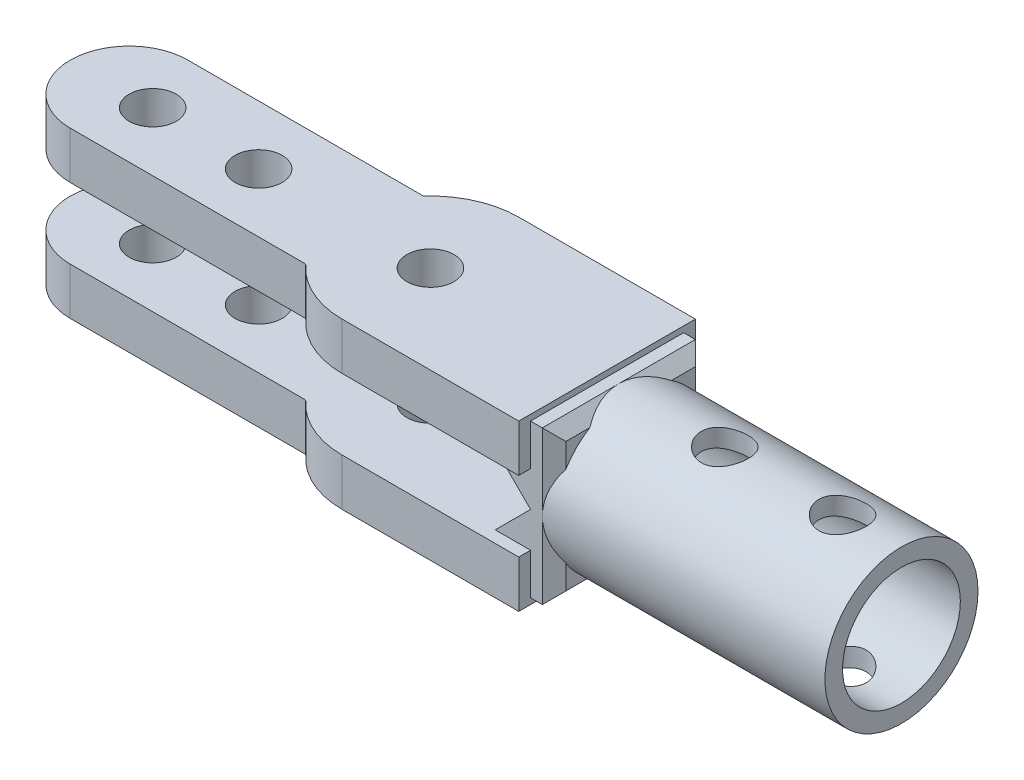
from build123d import *

# Parameters (mm, degrees)
SKETCH1_R               = 6.5
SKETCH1_R_2             = 5
BOSS_EXTRUDE1_DEPTH     = 23
SKETCH2_W               = 13
SKETCH2_H               = 13
BOSS_EXTRUDE2_DEPTH     = 2
CUT_EXTRUDE1_DEPTH      = 25.768932153
CUT_EXTRUDE1_DEPTH_BACK = 25.768932153
SKETCH4_R               = 2
SKETCH5_R               = 2
BOSS_EXTRUDE5_DEPTH     = 4
CHAMFER2_SIZE           = 3
CHAMFER3_SIZE           = 1


# Some blends are built 0.0001 mm under size
with BuildPart() as part:
    # Sketch1 → Boss-Extrude1 (new body)
    with BuildSketch(Plane(origin=(0, 0, 0), x_dir=(0, 0, -1), z_dir=(1, 0, 0))):
        Circle(SKETCH1_R)
        Circle(SKETCH1_R_2, mode=Mode.SUBTRACT)
    extrude(amount=BOSS_EXTRUDE1_DEPTH)

    # Sketch2 → Boss-Extrude2 (add)
    with BuildSketch(Plane(origin=(0, 0, 0), x_dir=(0, 0, -1), z_dir=(1, 0, 0))):
        Rectangle(SKETCH2_W, SKETCH2_H)
    extrude(amount=-BOSS_EXTRUDE2_DEPTH)

    # Sketch4 → Cut-Extrude1 (cut, two sides: drawn at the far end of the back side and taken through both)
    with BuildSketch(Plane(origin=(0, 0, 0), x_dir=(1, 0, 0), z_dir=(0, 1, 0)).offset(-CUT_EXTRUDE1_DEPTH_BACK)):
        with Locations(Location((8, 0, 0), (0, 0, 270))):
            Circle(SKETCH4_R)
        with Locations(Location((18, 0, 0), (0, 0, 270))):
            Circle(SKETCH4_R)
    extrude(amount=CUT_EXTRUDE1_DEPTH + CUT_EXTRUDE1_DEPTH_BACK, mode=Mode.SUBTRACT)

    # Sketch5 → Boss-Extrude5 (add)
    with BuildSketch(Plane(origin=(0, 7, 0), x_dir=(1, 0, 0), z_dir=(0, 1, 0))):
        with BuildLine():
            Line((-2, 7.5), (-2, -7.5))
            Line((-2, -7.5), (-17, -7.5))
            ThreePointArc((-17, -7.5), (-20.061862178, -6.846531969), (-22.590169944, -5))
            Line((-22.590169944, -5), (-42.590169944, -5))
            ThreePointArc((-42.590169944, -5), (-47.590169944, 0), (-42.590169944, 5))
            Line((-42.590169944, 5), (-22.590169944, 5))
            ThreePointArc((-22.590169944, 5), (-20.061862178, 6.846531969), (-17, 7.5))
            Line((-17, 7.5), (-2, 7.5))
        make_face()
        with Locations(Location((-40.590169944, 0, 0), (0, 0, 270))):
            Circle(SKETCH5_R, mode=Mode.SUBTRACT)
        with Locations(Location((-17, 0, 0), (0, 0, 270))):
            Circle(SKETCH5_R, mode=Mode.SUBTRACT)
        with Locations(Location((-31.590169944, 0, 0), (0, 0, 270))):
            Circle(SKETCH5_R, mode=Mode.SUBTRACT)
    boss_extrude5 = extrude(amount=-BOSS_EXTRUDE5_DEPTH)

    # Mirror2: Boss-Extrude5 across plane
    add(boss_extrude5.mirror(Plane.ZX))

    # Chamfer2
    chamfer2_edges = [part.edges().sort_by_distance(p)[0] for p in [
        (-2, 3, 0),
        (-2, -3, 0),
    ]]
    chamfer(chamfer2_edges, length=CHAMFER2_SIZE - 0.0001)  # a hair under: the kernel refuses the full size

    # Chamfer3
    # the kernel refuses this chamfer: 1 mm, written as the material it takes off along each edge
    with BuildSketch(Plane(origin=(0, 9.071682988, -6.5), x_dir=(-0.9996219169112968, 0, -0.027495876610586494), z_dir=(0, -1, 0))) as chamfer3_piece_1_section:
        Polygon((CHAMFER3_SIZE * 0.999621916911, -CHAMFER3_SIZE * 0.0274958766106), (-CHAMFER3_SIZE * 0.0274958766106, -CHAMFER3_SIZE * 0.999621916911), (0, 0), align=None)
    chamfer3_piece_1 = extrude(amount=9.071682988, mode=Mode.PRIVATE)
    chamfer3_piece_1 = chamfer3_piece_1 - Plane(origin=(-0.352424936, 0, 0), x_dir=(0, 0, -1), z_dir=(-1, 0, 0)) * Cylinder(6.5, 23, mode=Mode.PRIVATE)
    add(chamfer3_piece_1, mode=Mode.SUBTRACT)
    with BuildSketch(Plane(origin=(0, 6.5, 2.6e-08), x_dir=(-0.9996219169112968, 0.027495876610586494, 0), z_dir=(0, 0, -1))) as chamfer3_piece_2_section:
        Polygon((CHAMFER3_SIZE * 0.999621916911, -CHAMFER3_SIZE * 0.0274958766106), (-CHAMFER3_SIZE * 0.0274958766106, -CHAMFER3_SIZE * 0.999621916911), (0, 0), align=None)
    chamfer3_piece_2 = extrude(amount=9.071683014, mode=Mode.PRIVATE)
    chamfer3_piece_2 = chamfer3_piece_2 - Plane(origin=(-0.352424936, 0, 0), x_dir=(0, 0, -1), z_dir=(-1, 0, 0)) * Cylinder(6.5, 23, mode=Mode.PRIVATE)
    add(chamfer3_piece_2, mode=Mode.SUBTRACT)
    with BuildSketch(Plane(origin=(0, 6.5, 9.071682988), x_dir=(-0.9996219169112968, 0.027495876610586494, 0), z_dir=(0, 0, -1))) as chamfer3_piece_3_section:
        Polygon((CHAMFER3_SIZE * 0.999621916911, -CHAMFER3_SIZE * 0.0274958766106), (-CHAMFER3_SIZE * 0.0274958766106, -CHAMFER3_SIZE * 0.999621916911), (0, 0), align=None)
    chamfer3_piece_3 = extrude(amount=9.071682962, mode=Mode.PRIVATE)
    chamfer3_piece_3 = chamfer3_piece_3 - Plane(origin=(-0.352424936, 0, 0), x_dir=(0, 0, -1), z_dir=(-1, 0, 0)) * Cylinder(6.5, 23, mode=Mode.PRIVATE)
    add(chamfer3_piece_3, mode=Mode.SUBTRACT)
    with BuildSketch(Plane(origin=(0, -8e-09, 6.5), x_dir=(-0.9996219169112968, 0, 0.027495876610586494), z_dir=(0, 1, 0))) as chamfer3_piece_4_section:
        Polygon((CHAMFER3_SIZE * 0.999621916911, -CHAMFER3_SIZE * 0.0274958766106), (-CHAMFER3_SIZE * 0.0274958766106, -CHAMFER3_SIZE * 0.999621916911), (0, 0), align=None)
    chamfer3_piece_4 = extrude(amount=9.071682996, mode=Mode.PRIVATE)
    chamfer3_piece_4 = chamfer3_piece_4 - Plane(origin=(-0.352424936, 0, 0), x_dir=(0, 0, -1), z_dir=(-1, 0, 0)) * Cylinder(6.5, 23, mode=Mode.PRIVATE)
    add(chamfer3_piece_4, mode=Mode.SUBTRACT)
    with BuildSketch(Plane(origin=(0, -9.071682988, 6.5), x_dir=(-0.9996219169112968, 0, 0.027495876610586494), z_dir=(0, 1, 0))) as chamfer3_piece_5_section:
        Polygon((CHAMFER3_SIZE * 0.999621916911, -CHAMFER3_SIZE * 0.0274958766106), (-CHAMFER3_SIZE * 0.0274958766106, -CHAMFER3_SIZE * 0.999621916911), (0, 0), align=None)
    chamfer3_piece_5 = extrude(amount=9.07168298, mode=Mode.PRIVATE)
    chamfer3_piece_5 = chamfer3_piece_5 - Plane(origin=(-0.352424936, 0, 0), x_dir=(0, 0, -1), z_dir=(-1, 0, 0)) * Cylinder(6.5, 23, mode=Mode.PRIVATE)
    add(chamfer3_piece_5, mode=Mode.SUBTRACT)
    with BuildSketch(Plane(origin=(0, -6.5, 0), x_dir=(-0.9996219169112968, -0.027495876610586494, 0), z_dir=(0, 0, 1))) as chamfer3_piece_6_section:
        Polygon((CHAMFER3_SIZE * 0.999621916911, -CHAMFER3_SIZE * 0.0274958766106), (-CHAMFER3_SIZE * 0.0274958766106, -CHAMFER3_SIZE * 0.999621916911), (0, 0), align=None)
    chamfer3_piece_6 = extrude(amount=9.071682988, mode=Mode.PRIVATE)
    chamfer3_piece_6 = chamfer3_piece_6 - Plane(origin=(-0.352424936, 0, 0), x_dir=(0, 0, -1), z_dir=(-1, 0, 0)) * Cylinder(6.5, 23, mode=Mode.PRIVATE)
    add(chamfer3_piece_6, mode=Mode.SUBTRACT)
    with BuildSketch(Plane(origin=(0, -6.5, -9.071682988), x_dir=(-0.9996219169112968, -0.027495876610586494, 0), z_dir=(0, 0, 1))) as chamfer3_piece_7_section:
        Polygon((CHAMFER3_SIZE * 0.999621916911, -CHAMFER3_SIZE * 0.0274958766106), (-CHAMFER3_SIZE * 0.0274958766106, -CHAMFER3_SIZE * 0.999621916911), (0, 0), align=None)
    chamfer3_piece_7 = extrude(amount=9.071682988, mode=Mode.PRIVATE)
    chamfer3_piece_7 = chamfer3_piece_7 - Plane(origin=(-0.352424936, 0, 0), x_dir=(0, 0, -1), z_dir=(-1, 0, 0)) * Cylinder(6.5, 23, mode=Mode.PRIVATE)
    add(chamfer3_piece_7, mode=Mode.SUBTRACT)
    with BuildSketch(Plane(origin=(0, 0, -6.5), x_dir=(-0.9996219169112968, 0, -0.027495876610586494), z_dir=(0, -1, 0))) as chamfer3_piece_8_section:
        Polygon((CHAMFER3_SIZE * 0.999621916911, -CHAMFER3_SIZE * 0.0274958766106), (-CHAMFER3_SIZE * 0.0274958766106, -CHAMFER3_SIZE * 0.999621916911), (0, 0), align=None)
    chamfer3_piece_8 = extrude(amount=9.071682988, mode=Mode.PRIVATE)
    chamfer3_piece_8 = chamfer3_piece_8 - Plane(origin=(-0.352424936, 0, 0), x_dir=(0, 0, -1), z_dir=(-1, 0, 0)) * Cylinder(6.5, 23, mode=Mode.PRIVATE)
    add(chamfer3_piece_8, mode=Mode.SUBTRACT)


solid = part.part
